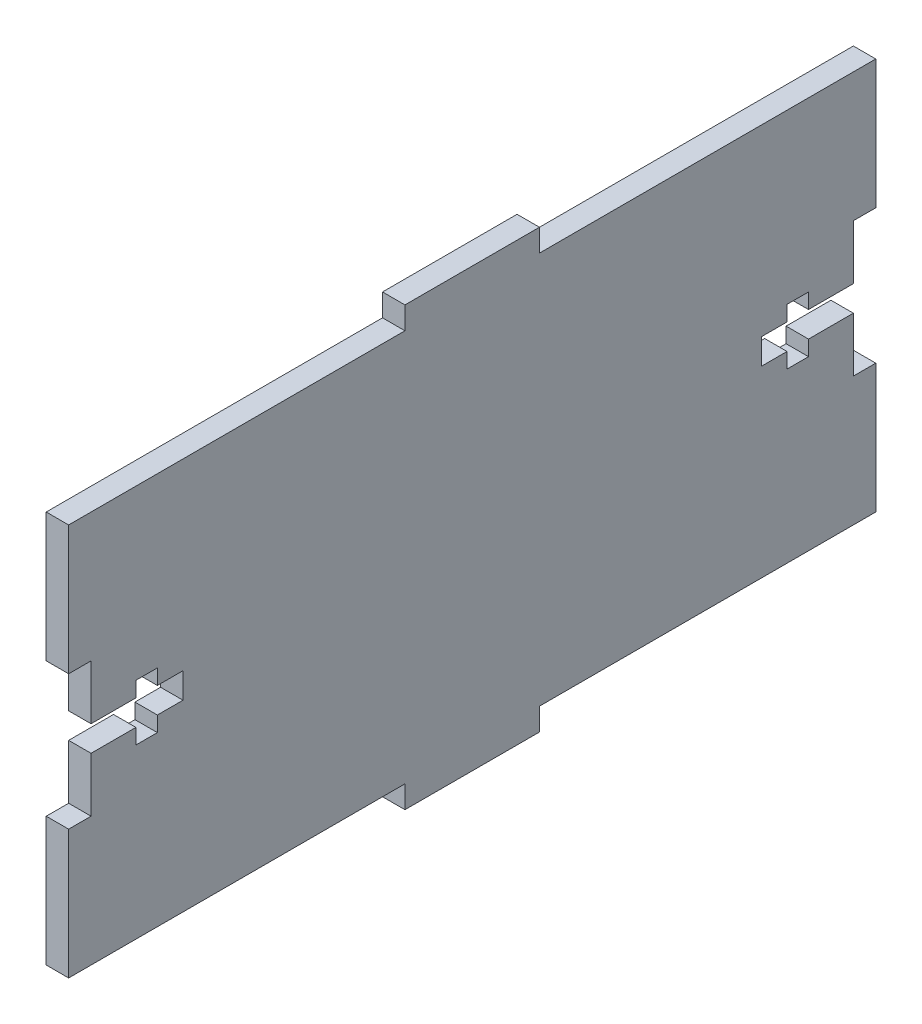
from build123d import *

# Parameters (mm, degrees)
BOSS_EXTRUDE1_DEPTH = 2.54


with BuildPart() as part:
    # Sketch2 → Boss-Extrude1 (new body)
    with BuildSketch(Plane(origin=(0, 0, 0), x_dir=(0, 0, -1), z_dir=(1, 0, 0))):
        Polygon((-45.72, 22.225), (-45.72, 7.62), (-43.18, 7.62), (-43.18, 1.4478), (-38.1, 1.4478), (-38.1, 3.175), (-35.66795, 3.175), (-35.66795, 1.4478), (-32.766, 1.4478), (-32.766, -1.4478), (-35.66795, -1.4478), (-35.66795, -3.175), (-38.1, -3.175), (-38.1, -1.4478), (-43.18, -1.4478), (-43.18, -7.62), (-45.72, -7.62), (-45.72, -22.225), (-7.62, -22.225), (-7.62, -24.765), (7.62, -24.765), (7.62, -22.225), (45.72, -22.225), (45.72, -7.62), (43.18, -7.62), (43.18, -1.4478), (38.1, -1.4478), (38.1, -3.175), (35.66795, -3.175), (35.66795, -1.4478), (32.766, -1.4478), (32.766, 1.4478), (35.66795, 1.4478), (35.66795, 3.175), (38.1, 3.175), (38.1, 1.4478), (43.18, 1.4478), (43.18, 7.62), (45.72, 7.62), (45.72, 22.225), (7.62, 22.225), (7.62, 24.765), (-7.62, 24.765), (-7.62, 22.225), align=None)
    extrude(amount=BOSS_EXTRUDE1_DEPTH)


solid = part.part
